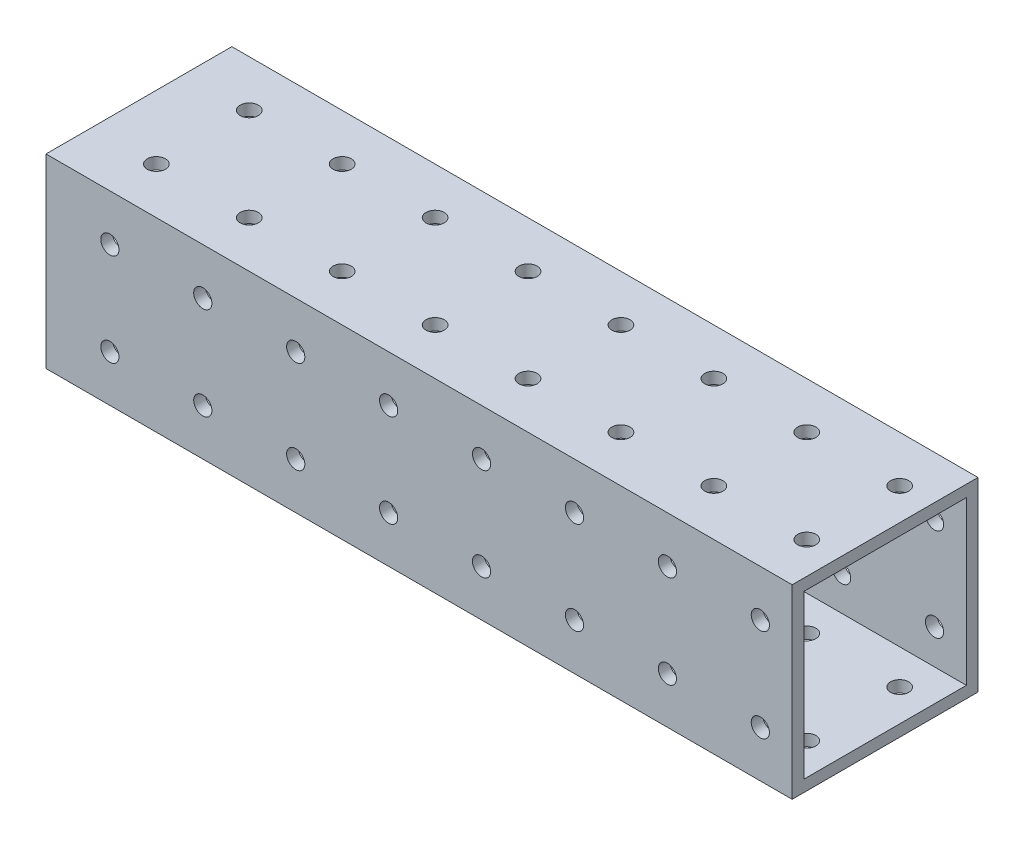
from build123d import *

# Parameters (mm, degrees)
SKETCH1_W           = 50.8
SKETCH1_H           = 50.8
BOSS_EXTRUDE1_DEPTH = 203.968109716
SHELL1_T            = -3.175
SKETCH2_R           = 2.4892
CUT_EXTRUDE3_DEPTH  = 217.250479262
SKETCH3_R           = 2.4892
CUT_EXTRUDE2_DEPTH  = 217.250479262
LPATTERN1_COUNT     = 8
LPATTERN1_PITCH     = 25.4


with BuildPart() as part:
    # Sketch1 → Boss-Extrude1 (new body)
    with BuildSketch(Plane(origin=(0, 0, 0), x_dir=(0, 0, -1), z_dir=(1, 0, 0))):
        with Locations((25.4, 25.4)):
            Rectangle(SKETCH1_W, SKETCH1_H)
    extrude(amount=BOSS_EXTRUDE1_DEPTH)

    # Shell1
    shell1_openings = [part.faces().sort_by_distance(p)[0] for p in [
        (0, 25.4, -25.4),
        (203.968109716, 25.4, -25.4),
    ]]
    offset(amount=SHELL1_T, openings=shell1_openings, kind=Kind.INTERSECTION)

    # Sketch2 → Cut-Extrude3 (cut, through all)
    with BuildSketch(Plane(origin=(0, 0, -50.8), x_dir=(-1, 0, 0), z_dir=(0, 0, -1))):
        with Locations((-195.262494158, 38.1)):
            Circle(SKETCH2_R)
        with Locations((-195.262494158, 12.7)):
            Circle(SKETCH2_R)
    cut_extrude3 = extrude(amount=-CUT_EXTRUDE3_DEPTH, mode=Mode.SUBTRACT)

    # Sketch3 → Cut-Extrude2 (cut, through all)
    with BuildSketch(Plane.XZ):
        with Locations((195.262494158, -12.7)):
            Circle(SKETCH3_R)
        with Locations((195.262494158, -38.1)):
            Circle(SKETCH3_R)
    cut_extrude2 = extrude(amount=-CUT_EXTRUDE2_DEPTH, mode=Mode.SUBTRACT)

    # LPattern1: Cut-Extrude3, Cut-Extrude2 ×8
    with Locations(*[(-i * LPATTERN1_PITCH, 0, 0) for i in range(1, LPATTERN1_COUNT)]):
        add(cut_extrude3, mode=Mode.SUBTRACT)
        add(cut_extrude2, mode=Mode.SUBTRACT)


solid = part.part
